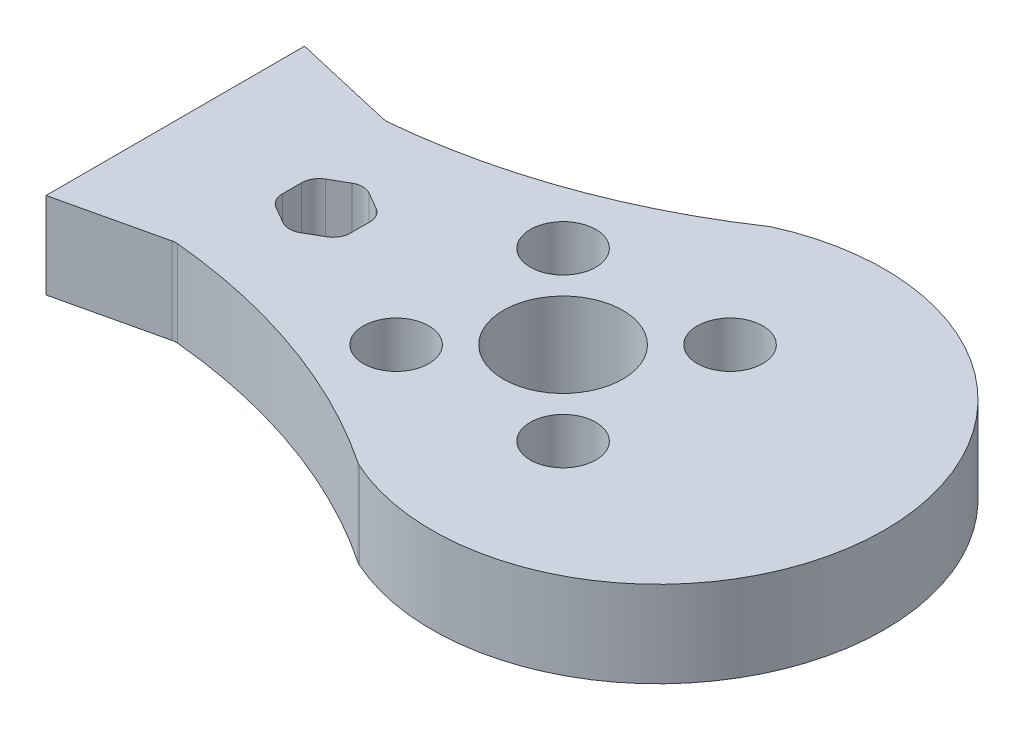
from build123d import *

# Parameters (mm, degrees)
SKETCH1_R           = 4.826
SKETCH1_R_2         = 8.79475
BOSS_EXTRUDE1_DEPTH = 12.7
FILLET1_R           = 2.54


with BuildPart() as part:
    # Sketch1 → Boss-Extrude1 (new body)
    with BuildSketch(Plane(origin=(0, 0, 0), x_dir=(1, 0, 0), z_dir=(0, 1, 0))):
        with BuildLine():
            Line((-41.681875222, 15.478902012), (-57.15, 19.05))
            Line((-57.15, 19.05), (-57.15, -19.05))
            Line((-57.15, -19.05), (-41.681875222, -15.478902012))
            ThreePointArc((-41.681875222, -15.478902012), (-19.794304612, -20.252343754), (0.205058151, -30.345756573))
            ThreePointArc((0.205058151, -30.345756573), (47.3456, 0), (0.205058151, 30.345756573))
            ThreePointArc((0.205058151, 30.345756573), (-19.794304612, 20.252343754), (-41.681875222, 15.478902012))
        make_face()
        Polygon((-34.925, -5.792555251), (-39.9415, -2.896277625), (-39.9415, 2.896277625), (-34.925, 5.792555251), (-29.9085, 2.896277625), (-29.9085, -2.896277625), align=None, mode=Mode.SUBTRACT)
        with Locations((-12.302950886, -12.302950886)):
            Circle(SKETCH1_R, mode=Mode.SUBTRACT)
        with Locations((12.302950886, -12.302950886)):
            Circle(SKETCH1_R, mode=Mode.SUBTRACT)
        Circle(SKETCH1_R_2, mode=Mode.SUBTRACT)
        with Locations((-12.302950886, 12.302950886)):
            Circle(SKETCH1_R, mode=Mode.SUBTRACT)
        with Locations((12.302950886, 12.302950886)):
            Circle(SKETCH1_R, mode=Mode.SUBTRACT)
    extrude(amount=BOSS_EXTRUDE1_DEPTH)

    # Fillet1
    fillet1_edges = [part.edges().sort_by_distance(p)[0] for p in [
        (-39.9415, 6.35, 2.896277625),
        (-34.925, 6.35, 5.792555251),
        (-29.9085, 6.35, 2.896277625),
        (-29.9085, 6.35, -2.896277625),
        (-34.925, 6.35, -5.792555251),
        (-39.9415, 6.35, -2.896277625),
        (0.205058151, 6.35, -30.345756573),
        (-41.681875222, 6.35, -15.478902012),
        (0.205058151, 6.35, 30.345756573),
        (-41.681875222, 6.35, 15.478902012),
    ]]
    fillet(fillet1_edges, radius=FILLET1_R)


solid = part.part
